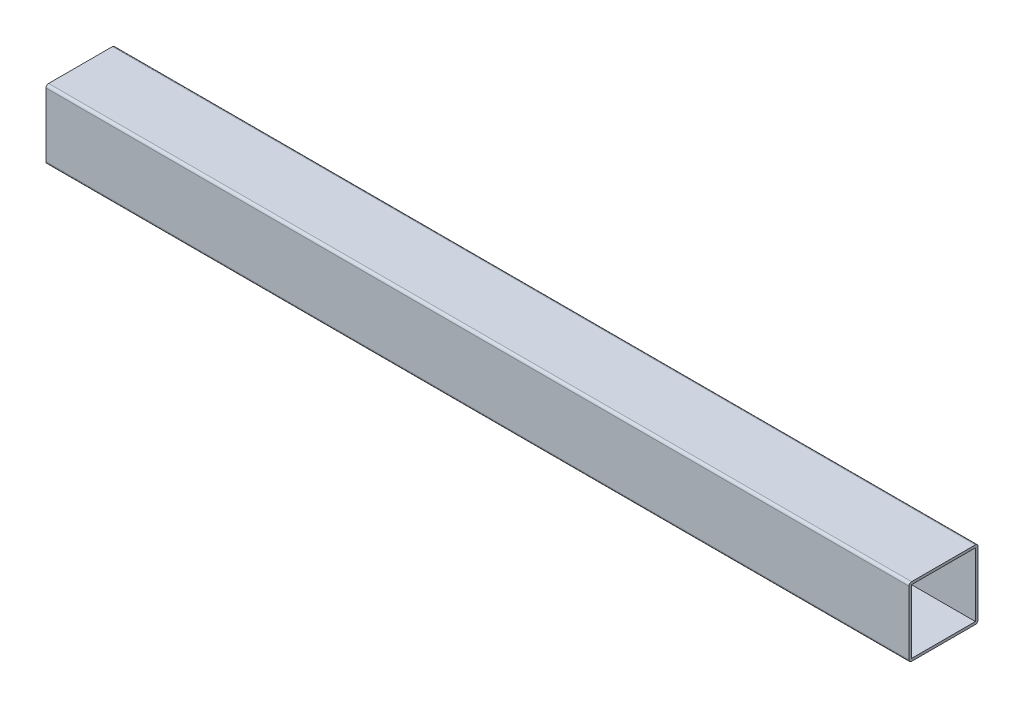
from build123d import *

# Parameters (mm, degrees)
SKETCH_1_W      = 74
SKETCH_1_H      = 74
EXTRUDE_1_DEPTH = 1000


with BuildPart() as part:
    # Эскиз1 → Вытянуть-Тонкостенный1 (new body)
    with BuildSketch(Plane(origin=(0, 0, 0), x_dir=(0, 0, -1), z_dir=(1, 0, 0))):
        with BuildLine():
            Line((0, 77), (0, 3))
            ThreePointArc((0, 3), (0.878679656, 0.878679656), (3, 0))
            Line((3, 0), (77, 0))
            ThreePointArc((77, 0), (79.121320344, 0.878679656), (80, 3))
            Line((80, 3), (80, 77))
            ThreePointArc((80, 77), (79.121320344, 79.121320344), (77, 80))
            Line((77, 80), (3, 80))
            ThreePointArc((3, 80), (0.878679656, 79.121320344), (0, 77))
        make_face()
        with Locations((40, 40)):
            Rectangle(SKETCH_1_W, SKETCH_1_H, mode=Mode.SUBTRACT)
    extrude(amount=EXTRUDE_1_DEPTH)


solid = part.part
